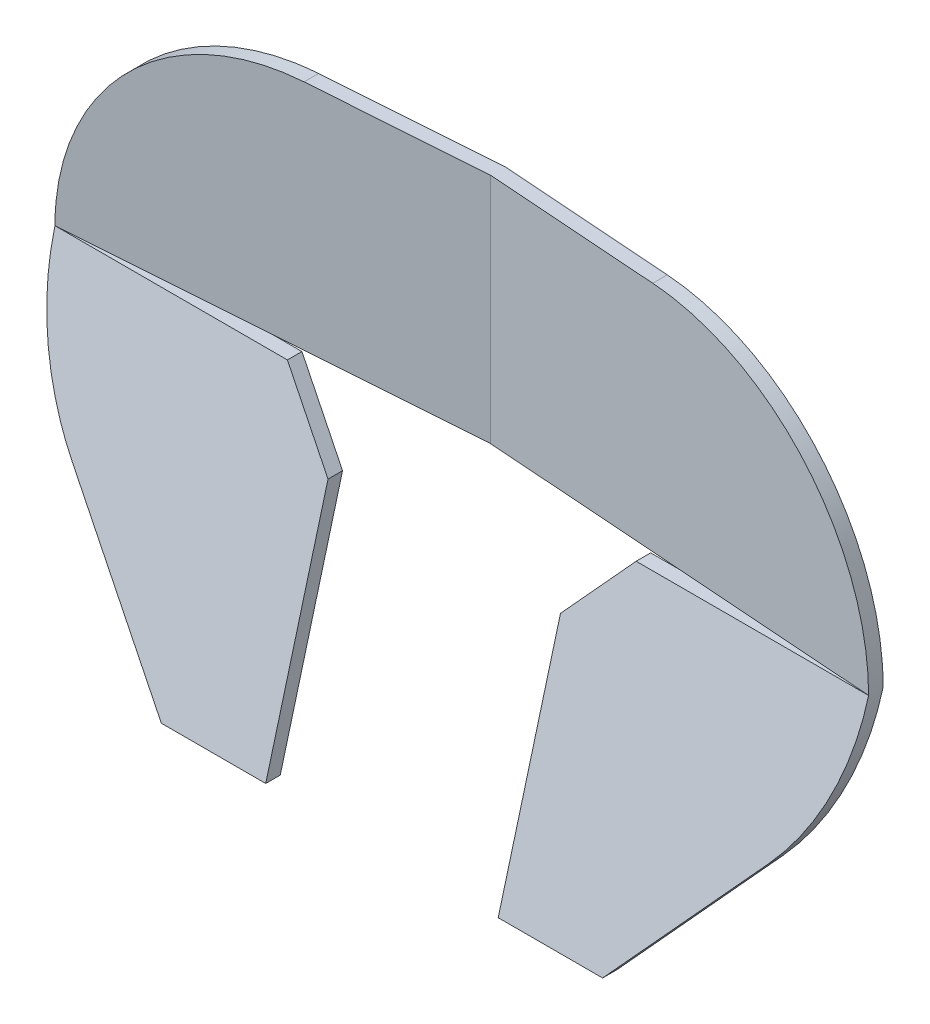
from build123d import *

# Parameters (mm, degrees)
BOSS_EXTRUDE1_DEPTH     = 152.4
CUT_EXTRUDE4_DEPTH      = 203.2
CUT_EXTRUDE5_DEPTH      = 605.955649982
CUT_EXTRUDE5_DEPTH_BACK = 605.955649982


with BuildPart() as part:
    # Sketch1 → Boss-Extrude1 (new body)
    with BuildSketch(Plane.XY):
        with BuildLine():
            Line((341.74060652, 162.46889182), (290.94060652, 105.31889182))
            Line((290.94060652, 105.31889182), (290.94060652, -97.88110818))
            Line((290.94060652, -97.88110818), (382.190830787, -97.88110818))
            Line((382.190830787, -97.88110818), (493.614180076, 27.47015977))
            ThreePointArc((493.614180076, 27.47015977), (527.107785859, 245.711001498), (341.74060652, 365.66889182))
            Line((341.74060652, 365.66889182), (36.94060652, 365.66889182))
            ThreePointArc((36.94060652, 365.66889182), (-148.42657282, 245.711001498), (-114.932967037, 27.47015977))
            Line((-114.932967037, 27.47015977), (-3.509617748, -97.88110818))
            Line((-3.509617748, -97.88110818), (87.74060652, -97.88110818))
            Line((87.74060652, -97.88110818), (87.74060652, 105.31889182))
            Line((87.74060652, 105.31889182), (36.94060652, 162.46889182))
            Line((36.94060652, 162.46889182), (87.74060652, 162.46889182))
            Line((87.74060652, 162.46889182), (290.94060652, 162.46889182))
            Line((290.94060652, 162.46889182), (341.74060652, 162.46889182))
        make_face()
    extrude(amount=BOSS_EXTRUDE1_DEPTH)

    # Sketch4 → Cut-Extrude4 (cut)
    with BuildSketch(Plane(origin=(0, 365.66889182, 0), x_dir=(1, 0, 0), z_dir=(0, 1, 0))):
        Polygon((189.34060652, 0), (-166.25939348, 0), (-166.25939348, -25.4), align=None)
        Polygon((189.34060652, 0), (544.94060652, -25.4), (544.94060652, 0), align=None)
        Polygon((-166.508671644, -152.4), (544.94060652, -152.4), (544.94060652, -38.1), (189.091328356, -12.7), (-166.508671644, -38.1), align=None)
    extrude(amount=-CUT_EXTRUDE4_DEPTH, mode=Mode.SUBTRACT)

    # Sketch5 → Cut-Extrude5 (cut, two sides: drawn at the far end of the back side and taken through both)
    with BuildSketch(Plane(origin=(87.74060652, 0, 0), x_dir=(0, 0, -1), z_dir=(1, 0, 0)).offset(-CUT_EXTRUDE5_DEPTH_BACK)):
        Polygon((-38.1, 162.46889182), (-152.4, 162.46889182), (-152.4, -97.88110818), (-107.860572249, -97.88110818), align=None)
        Polygon((0, -97.88110818), (0, 162.46889182), (-25.4, 162.46889182), (-95.160572249, -97.88110818), align=None)
    extrude(amount=CUT_EXTRUDE5_DEPTH + CUT_EXTRUDE5_DEPTH_BACK, mode=Mode.SUBTRACT)


solid = part.part
